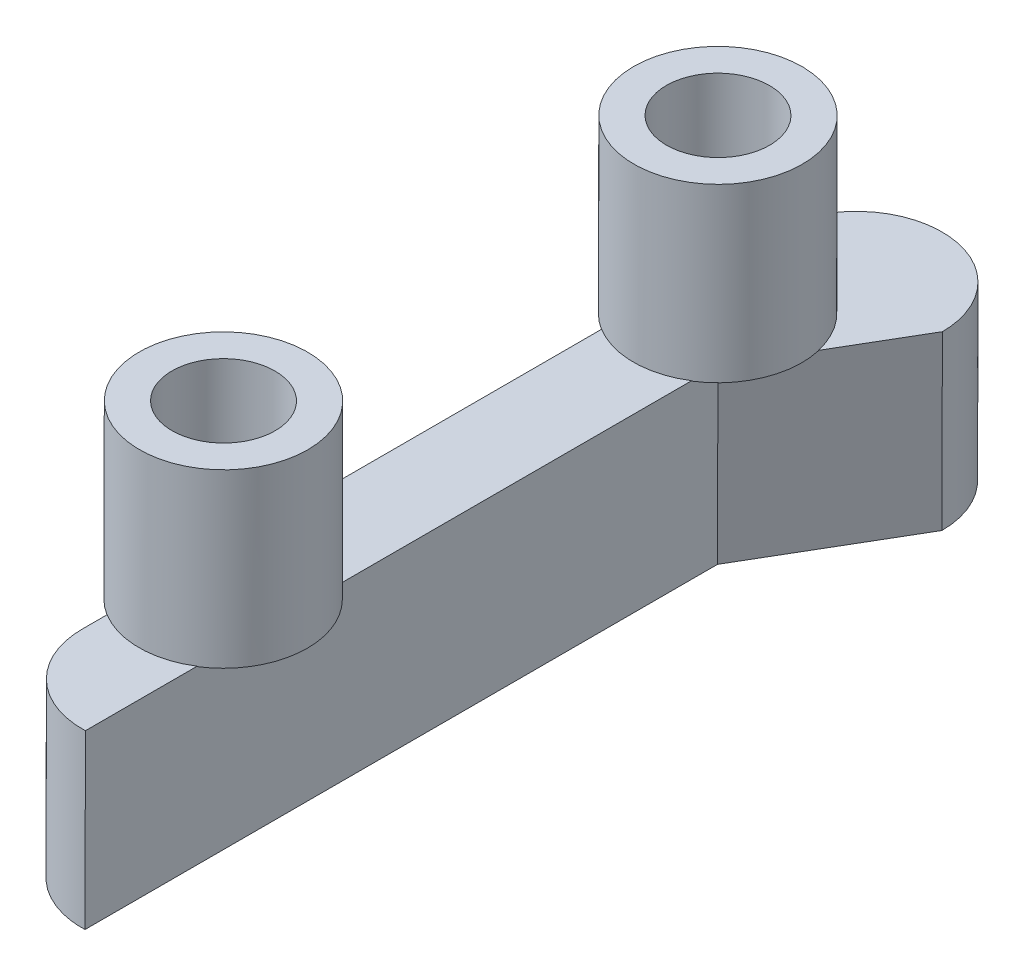
from build123d import *

# Parameters (mm, degrees)
BOSS_EXTRUDE1_DEPTH      = 0.01
BOSS_EXTRUDE1_DEPTH_BACK = 5
SKETCH5_R                = 2.45
SKETCH5_R_2              = 1.5
BOSS_EXTRUDE2_DEPTH      = 5


with BuildPart() as part:
    # Sketch1 → Boss-Extrude1 (new, two sides: drawn at the far end of the back side and taken through both)
    with BuildSketch(Plane(origin=(0.212370974, 88.261171587, 0), x_dir=(0.9999971051966906, -0.0024061583985667905, 0), z_dir=(0.0024061583985667905, 0.9999971051966906, 2.2915916530952404e-15)).offset(-BOSS_EXTRUDE1_DEPTH_BACK)):
        with BuildLine():
            add(Edge.make_bspline(
                [(62.098697441, -271.553297735), (62.098697441, -271.390083561), (62.082868678, -271.227746225), (62.018744893, -270.904868209), (61.970774481, -270.747219765), (61.846181156, -270.44635233), (61.768554488, -270.300830702), (61.586127547, -270.027822449), (61.482834878, -269.902064788), (61.252588694, -269.671493322), (61.124154836, -269.565937636), (60.85291301, -269.384527638), (60.709509325, -269.307646832), (60.406882072, -269.181865969), (60.248191704, -269.13364771), (59.928627436, -269.06981324), (59.765989129, -269.053431748), (59.435435386, -269.053165346), (59.272896926, -269.069262853), (58.953071086, -269.132607362), (58.794102275, -269.180650645), (58.491413646, -269.30591032), (58.347818746, -269.382585434), (58.075961384, -269.563834415), (57.947444391, -269.669183663), (57.601723344, -270.014407111), (57.415265036, -270.29289619), (57.16528984, -270.894119026), (57.098697441, -271.222630203), (57.098697441, -271.553297735)],
                knots=[0, 0, 0, 0, 0.0625, 0.0625, 0.125, 0.125, 0.1875, 0.1875, 0.25, 0.25, 0.3125, 0.3125, 0.375, 0.375, 0.4375, 0.4375, 0.5, 0.5, 0.5625, 0.5625, 0.625, 0.625, 0.6875, 0.6875, 0.75, 0.75, 0.875, 0.875, 1, 1, 1, 1], degree=3))
            Line((57.098697441, -271.553297735), (57.098697441, -288.700730466))
            add(Edge.make_bspline(
                [(57.098697441, -291.553297735), (57.098716176, -291.500037735), (57.098733901, -291.446736965), (57.098944046, -290.775972975), (57.098997483, -290.169015827), (57.098876087, -289.279212217), (57.098803426, -288.988725401), (57.098697441, -288.700730466)],
                knots=[0.466050383, 0.466050383, 0.466050383, 0.466050383, 0.46875, 0.46875, 0.5, 0.5, 0.515336825, 0.515336825, 0.515336825, 0.515336825], degree=3))
            add(Edge.make_bspline(
                [(59.695767456, -294.051424481), (59.664952853, -294.052615647), (59.634064807, -294.053239292), (59.43288412, -294.053593818), (59.260500841, -294.036058258), (58.929915117, -293.968086951), (58.767684875, -293.9170646), (58.460210959, -293.785297782), (58.316149887, -293.70550705), (58.0458038, -293.51937365), (57.92043612, -293.413227178), (57.583512234, -293.067438733), (57.404616617, -292.79348169), (57.223603479, -292.349815403), (57.176716166, -292.193718571), (57.11440851, -291.876470519), (57.098697441, -291.715881831), (57.098697441, -291.553297735)],
                knots=[0.488631618, 0.488631618, 0.488631618, 0.488631618, 0.5, 0.5, 0.5625, 0.5625, 0.625, 0.625, 0.6875, 0.6875, 0.75, 0.75, 0.875, 0.875, 0.9375, 0.9375, 1, 1, 1, 1], degree=3))
            Line((59.695767456, -294.051424481), (59.695767456, -275.672418356))
            Line((59.695767456, -275.672418356), (62.098697441, -271.553297735))
        make_face()
    extrude(amount=BOSS_EXTRUDE1_DEPTH + BOSS_EXTRUDE1_DEPTH_BACK)

    # Sketch5 → Boss-Extrude2 (add)
    # profile 1 of 2: a face of its own
    with BuildSketch(Plane(origin=(0.212370974, 88.261171587, 0), x_dir=(0.9999971051966906, -0.0024061583985667905, 0), z_dir=(0.0024061583985667905, 0.9999971051966906, 2.2915916530952404e-15))):
        with Locations((58.382444571, -274.369066811)):
            Circle(SKETCH5_R)
        with Locations((58.382444571, -274.369066811)):
            Circle(SKETCH5_R_2, mode=Mode.SUBTRACT)
    # profile 2 of 2: a face of its own
    with BuildSketch(Plane(origin=(0.212370974, 88.261171587, 0), x_dir=(0.9999971051966906, -0.0024061583985667905, 0), z_dir=(0.0024061583985667905, 0.9999971051966906, 2.2915916530952404e-15))):
        with Locations((58.382444571, -288.73753777)):
            Circle(SKETCH5_R)
        with Locations((58.382444571, -288.73753777)):
            Circle(SKETCH5_R_2, mode=Mode.SUBTRACT)
    extrude(amount=BOSS_EXTRUDE2_DEPTH)


solid = part.part
